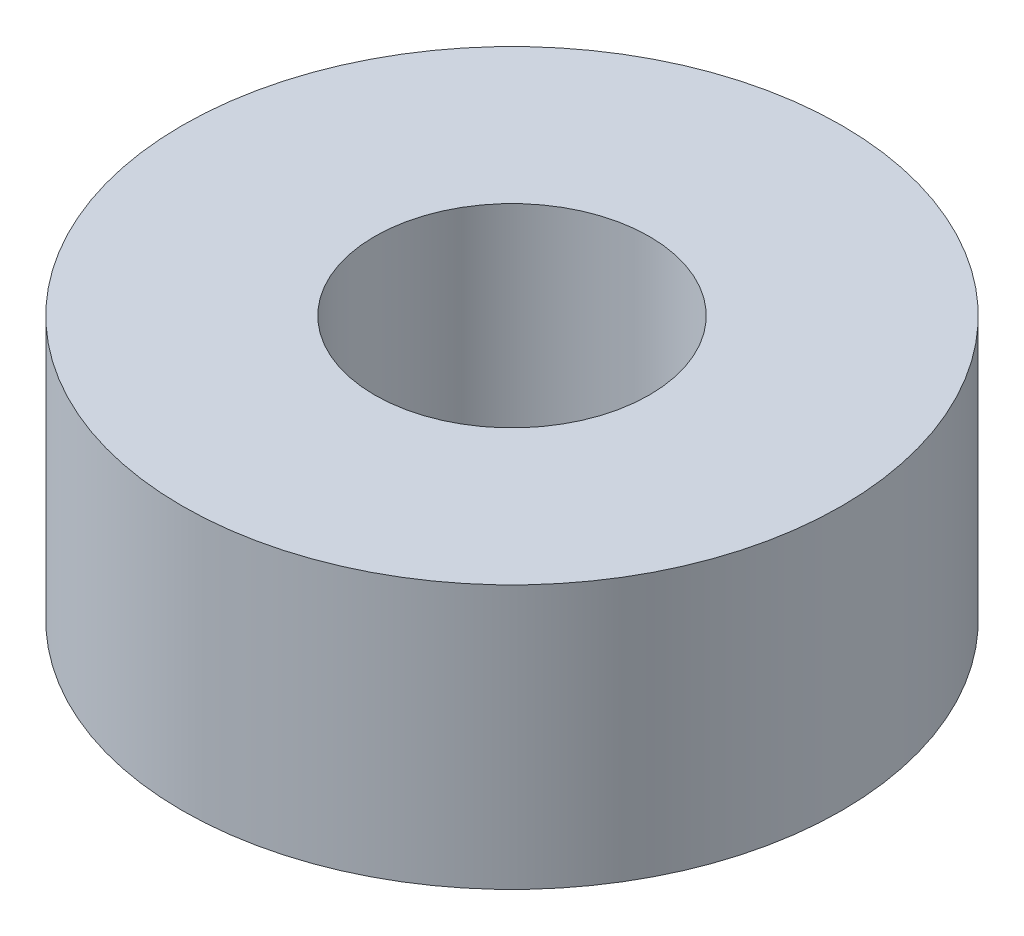
from build123d import *

# Parameters (mm, degrees)
SKETCH1_R           = 30
BOSS_EXTRUDE1_DEPTH = 24
SKETCH2_R           = 12.5
CUT_EXTRUDE1_DEPTH  = 49.744230428


with BuildPart() as part:
    # Sketch1 → Boss-Extrude1 (new body)
    with BuildSketch(Plane(origin=(0, 0, 0), x_dir=(1, 0, 0), z_dir=(0, 1, 0))):
        Circle(SKETCH1_R)
    extrude(amount=BOSS_EXTRUDE1_DEPTH)

    # Sketch2 → Cut-Extrude1 (cut, through all)
    with BuildSketch(Plane(origin=(0, 0, 0), x_dir=(1, 0, 0), z_dir=(0, 1, 0))):
        Circle(SKETCH2_R)
    extrude(amount=CUT_EXTRUDE1_DEPTH, mode=Mode.SUBTRACT)


solid = part.part
